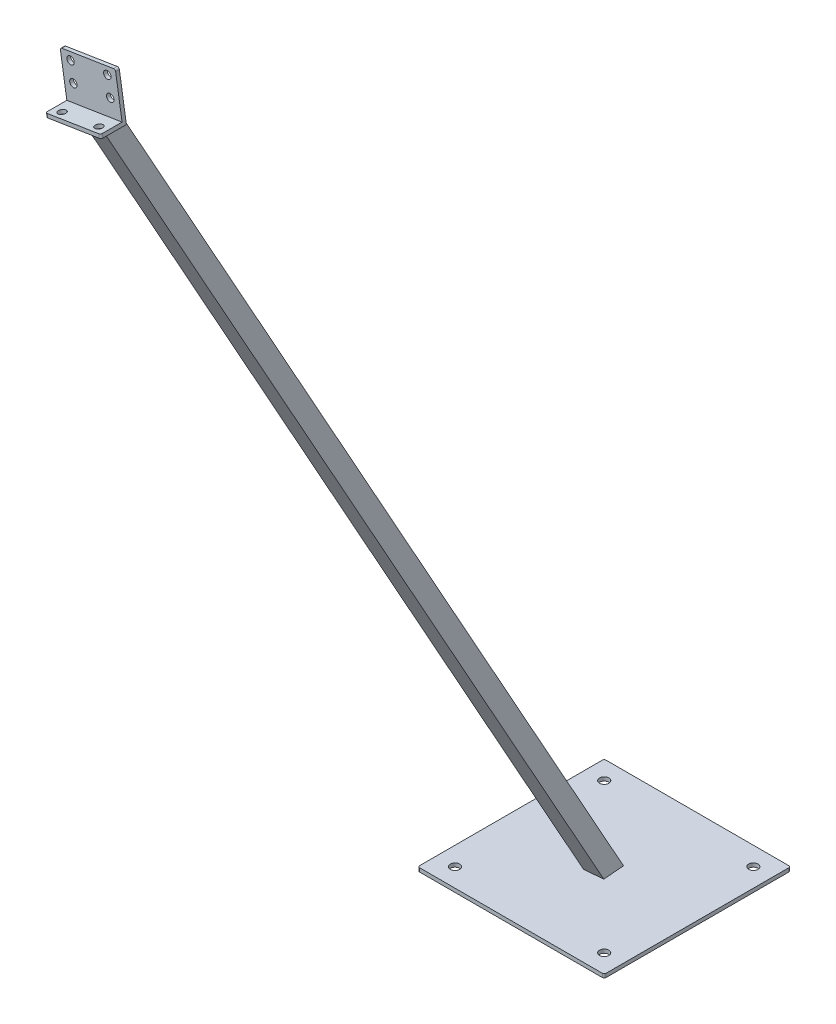
from build123d import *

# Parameters (mm, degrees)
BOSS_EXTRUDE1_DEPTH      = 60
BOSS_EXTRUDE2_DEPTH      = 2000
BOSS_EXTRUDE2_DEPTH_BACK = 20
SKETCH3_W                = 20
SKETCH3_H                = 20
SKETCH3_W_2              = 18
SKETCH3_H_2              = 18
CUT_EXTRUDE1_DEPTH       = 60
SKETCH7_W                = 200
SKETCH7_H                = 200
BOSS_EXTRUDE3_DEPTH      = 4
SKETCH8_W                = 109.20231627
SKETCH8_H                = 482.966945154
CUT_EXTRUDE3_DEPTH       = 1000
CUT_EXTRUDE4_REACH       = 1228.081
SKETCH9_R                = 3.999999996
CUT_EXTRUDE5_REACH       = 1228.081
SKETCH10_R               = 4.000000003
CUT_EXTRUDE6_REACH       = 1249.32
SKETCH11_R               = 5
FILLET1_R                = 2
FILLET2_R                = 2
BODY_MOVE_COPY1_ANGLE    = 9


with BuildPart() as part:
    # Sketch1 → Boss-Extrude1 (new body)
    with BuildSketch(Plane(origin=(0, 0, 0), x_dir=(0, 0, -1), z_dir=(1, 0, 0))):
        Polygon((0, 0), (0, 50), (-4, 50), (-4, 4), (-27, 4), (-27, 0), align=None)
    extrude(amount=BOSS_EXTRUDE1_DEPTH)

    # Sketch3 → Boss-Extrude2 (add, two sides: drawn at the far end of the back side and taken through both)
    with BuildSketch(Plane(origin=(0.734152256, 4.01424851, 2.317627458), x_dir=(0, -0.49999999999998884, 0.866025403784445), z_dir=(-0.1564344650402179, -0.8553631939770945, -0.4938441702975589)).offset(-BOSS_EXTRUDE2_DEPTH_BACK)):
        with Locations((0, -29.630650218)):
            Rectangle(SKETCH3_W, SKETCH3_H)
        with Locations((0, -29.630650218)):
            Rectangle(SKETCH3_W_2, SKETCH3_H_2, mode=Mode.SUBTRACT)
    extrude(amount=BOSS_EXTRUDE2_DEPTH + BOSS_EXTRUDE2_DEPTH_BACK)

    # Sketch5 → Cut-Extrude1 (cut)
    with BuildSketch(Plane.ZY):
        Polygon((4, 4), (4, 36.054903459), (38.781358344, 4), align=None)
    extrude(amount=-CUT_EXTRUDE1_DEPTH, mode=Mode.SUBTRACT)

    # Sketch7 → Boss-Extrude3 (add)
    with BuildSketch(Plane(origin=(-155.547262091, -982.086761679, 2e-09), x_dir=(0.9876883405962854, -0.15643446503298483, 2.850074130140158e-13), z_dir=(0.15643446503298483, 0.9876883405962854, -1.7994659856963007e-12))):
        with Locations((5.477031178, 566.441418592)):
            Rectangle(SKETCH7_W, SKETCH7_H)
    extrude(amount=BOSS_EXTRUDE3_DEPTH)

    # Sketch8 → Cut-Extrude3 (cut)
    with BuildSketch(Plane(origin=(-155.547262091, -982.086761679, 2e-09), x_dir=(0.9876883405962856, -0.15643446503298414, -2.6345368338963644e-10), z_dir=(-0.15643446503298414, -0.9876883405962856, 1.799719805411024e-12))):
        with Locations((4.33544583, -787.065663544)):
            Rectangle(SKETCH8_W, SKETCH8_H)
    extrude(amount=CUT_EXTRUDE3_DEPTH, mode=Mode.SUBTRACT)

    # Sketch9 → Cut-Extrude4 (cut, up to next)
    with BuildSketch(Plane(origin=(0, 0, 0), x_dir=(-1, 0, 0), z_dir=(0, 0, -1)), mode=Mode.PRIVATE) as cut_extrude4_sk1:
        with Locations((-50, 22)):
            Circle(SKETCH9_R)
    cut_extrude4_tool1 = extrude(cut_extrude4_sk1.sketch, amount=-CUT_EXTRUDE4_REACH, mode=Mode.PRIVATE) & part.part
    # Sketch9 → Cut-Extrude4 (cut, up to next)
    with BuildSketch(Plane(origin=(0, 0, 0), x_dir=(-1, 0, 0), z_dir=(0, 0, -1)), mode=Mode.PRIVATE) as cut_extrude4_sk2:
        with Locations((-10, 22)):
            Circle(SKETCH9_R)
    cut_extrude4_tool2 = extrude(cut_extrude4_sk2.sketch, amount=-CUT_EXTRUDE4_REACH, mode=Mode.PRIVATE) & part.part
    # Sketch9 → Cut-Extrude4 (cut, up to next)
    with BuildSketch(Plane(origin=(0, 0, 0), x_dir=(-1, 0, 0), z_dir=(0, 0, -1)), mode=Mode.PRIVATE) as cut_extrude4_sk3:
        with Locations((-10, 42)):
            Circle(SKETCH9_R)
    cut_extrude4_tool3 = extrude(cut_extrude4_sk3.sketch, amount=-CUT_EXTRUDE4_REACH, mode=Mode.PRIVATE) & part.part
    # Sketch9 → Cut-Extrude4 (cut, up to next)
    with BuildSketch(Plane(origin=(0, 0, 0), x_dir=(-1, 0, 0), z_dir=(0, 0, -1)), mode=Mode.PRIVATE) as cut_extrude4_sk4:
        with Locations((-50, 42)):
            Circle(SKETCH9_R)
    cut_extrude4_tool4 = extrude(cut_extrude4_sk4.sketch, amount=-CUT_EXTRUDE4_REACH, mode=Mode.PRIVATE) & part.part
    add(cut_extrude4_tool1.solids().sort_by_distance((50, 22, 0))[0], mode=Mode.SUBTRACT)
    add(cut_extrude4_tool2.solids().sort_by_distance((10, 22, 0))[0], mode=Mode.SUBTRACT)
    add(cut_extrude4_tool3.solids().sort_by_distance((10, 42, 0))[0], mode=Mode.SUBTRACT)
    add(cut_extrude4_tool4.solids().sort_by_distance((50, 42, 0))[0], mode=Mode.SUBTRACT)

    # Sketch10 → Cut-Extrude5 (cut, up to next)
    with BuildSketch(Plane.XZ, mode=Mode.PRIVATE) as cut_extrude5_sk1:
        with Locations(Location((50, 19, 0), (0, 0, 270))):
            Circle(SKETCH10_R)
    cut_extrude5_tool1 = extrude(cut_extrude5_sk1.sketch, amount=-CUT_EXTRUDE5_REACH, mode=Mode.PRIVATE) & part.part
    # Sketch10 → Cut-Extrude5 (cut, up to next)
    with BuildSketch(Plane.XZ, mode=Mode.PRIVATE) as cut_extrude5_sk2:
        with Locations(Location((10, 19, 0), (0, 0, 270))):
            Circle(SKETCH10_R)
    cut_extrude5_tool2 = extrude(cut_extrude5_sk2.sketch, amount=-CUT_EXTRUDE5_REACH, mode=Mode.PRIVATE) & part.part
    add(cut_extrude5_tool1.solids().sort_by_distance((50, 0, 19))[0], mode=Mode.SUBTRACT)
    add(cut_extrude5_tool2.solids().sort_by_distance((10, 0, 19))[0], mode=Mode.SUBTRACT)

    # Sketch11 → Cut-Extrude6 (cut, up to next)
    with BuildSketch(Plane(origin=(-155.547262091, -982.086761679, 2e-09), x_dir=(0.9876883405962856, -0.15643446503298414, -2.6345368338963665e-10), z_dir=(-0.15643446503298414, -0.9876883405962856, 1.7997198054110692e-12)), mode=Mode.PRIVATE) as cut_extrude6_sk1:
        with Locations((-74.522968646, -486.441418617)):
            Circle(SKETCH11_R)
    cut_extrude6_tool1 = extrude(cut_extrude6_sk1.sketch, amount=-CUT_EXTRUDE6_REACH, mode=Mode.PRIVATE) & part.part
    # Sketch11 → Cut-Extrude6 (cut, up to next)
    with BuildSketch(Plane(origin=(-155.547262091, -982.086761679, 2e-09), x_dir=(0.9876883405962856, -0.15643446503298414, -2.6345368338963665e-10), z_dir=(-0.15643446503298414, -0.9876883405962856, 1.7997198054110692e-12)), mode=Mode.PRIVATE) as cut_extrude6_sk2:
        with Locations((85.477031354, -486.441418617)):
            Circle(SKETCH11_R)
    cut_extrude6_tool2 = extrude(cut_extrude6_sk2.sketch, amount=-CUT_EXTRUDE6_REACH, mode=Mode.PRIVATE) & part.part
    # Sketch11 → Cut-Extrude6 (cut, up to next)
    with BuildSketch(Plane(origin=(-155.547262091, -982.086761679, 2e-09), x_dir=(0.9876883405962856, -0.15643446503298414, -2.6345368338963665e-10), z_dir=(-0.15643446503298414, -0.9876883405962856, 1.7997198054110692e-12)), mode=Mode.PRIVATE) as cut_extrude6_sk3:
        with Locations((85.477031354, -646.441418617)):
            Circle(SKETCH11_R)
    cut_extrude6_tool3 = extrude(cut_extrude6_sk3.sketch, amount=-CUT_EXTRUDE6_REACH, mode=Mode.PRIVATE) & part.part
    # Sketch11 → Cut-Extrude6 (cut, up to next)
    with BuildSketch(Plane(origin=(-155.547262091, -982.086761679, 2e-09), x_dir=(0.9876883405962856, -0.15643446503298414, -2.6345368338963665e-10), z_dir=(-0.15643446503298414, -0.9876883405962856, 1.7997198054110692e-12)), mode=Mode.PRIVATE) as cut_extrude6_sk4:
        with Locations((-74.522968646, -646.441418617)):
            Circle(SKETCH11_R)
    cut_extrude6_tool4 = extrude(cut_extrude6_sk4.sketch, amount=-CUT_EXTRUDE6_REACH, mode=Mode.PRIVATE) & part.part
    add(cut_extrude6_tool1.solids().sort_by_distance((-229.152729, -970.428801, -486.441419))[0], mode=Mode.SUBTRACT)
    add(cut_extrude6_tool2.solids().sort_by_distance((-71.122595, -995.458315, -486.441419))[0], mode=Mode.SUBTRACT)
    add(cut_extrude6_tool3.solids().sort_by_distance((-71.122595, -995.458315, -646.441419))[0], mode=Mode.SUBTRACT)
    add(cut_extrude6_tool4.solids().sort_by_distance((-229.152729, -970.428801, -646.441419))[0], mode=Mode.SUBTRACT)

    # Fillet1
    fillet1_edges = [part.edges().sort_by_distance(p)[0] for p in [
        (60, 50, 2),
        (60, 2, 27),
        (0, 2, 27),
        (0, 50, 2),
    ]]
    fillet(fillet1_edges, radius=FILLET1_R)

    # Fillet2
    fillet2_edges = [part.edges().sort_by_distance(p)[0] for p in [
        (-248.593627385, -965.324734939, -666.44141859),
        (-248.593627385, -965.324734938, -466.44141859),
        (-51.055959266, -996.611627945, -466.44141859),
        (-51.055959266, -996.611627945, -666.44141859),
    ]]
    fillet(fillet2_edges, radius=FILLET2_R)


with BuildPart() as part_1:
    # Body-Move/Copy1: read off the stored shape, not the designer's step
    # Body-Move/Copy1: moved
    add(part.part.moved(Location((1.9150449, 1006.4197144, 0))).rotate(Axis((0, 0, 0), (0, 0, 1)), BODY_MOVE_COPY1_ANGLE))


solid = part_1.part
